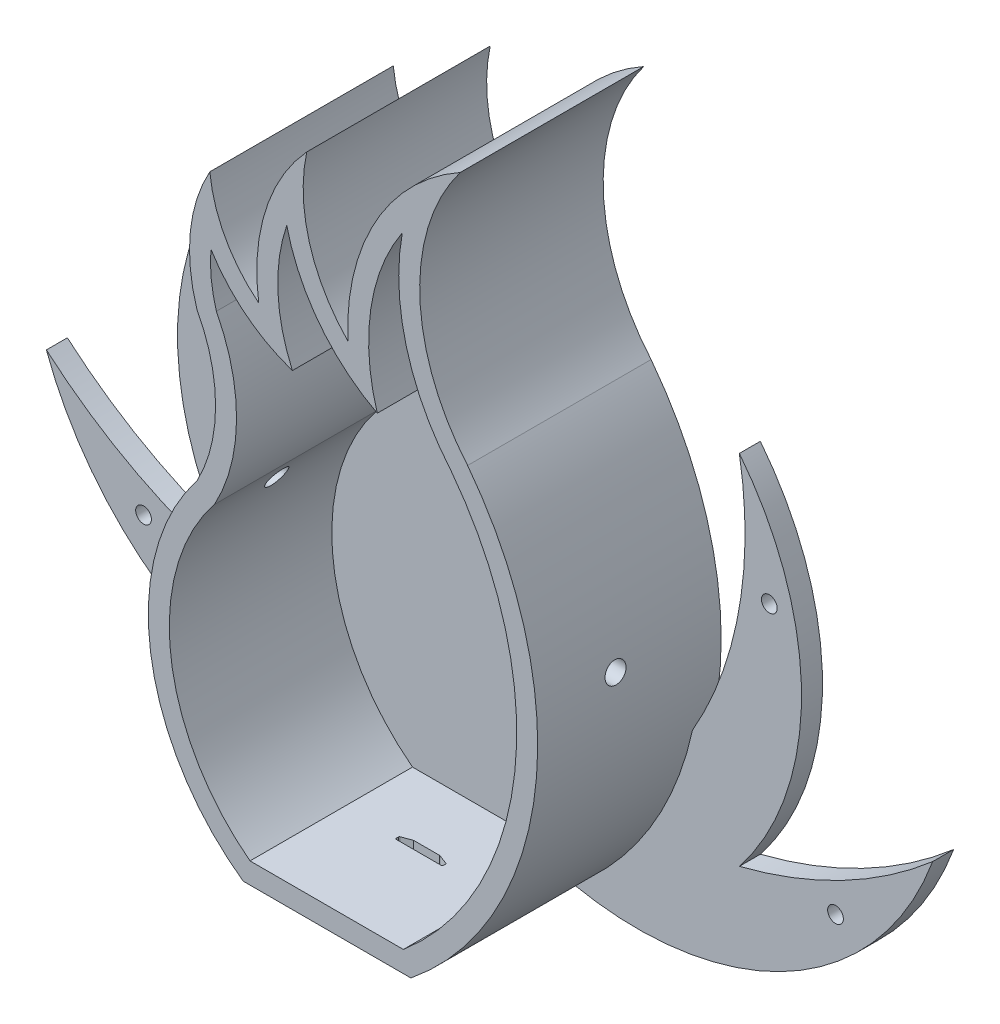
from build123d import *

# Parameters (mm, degrees)
BOSS_EXTRU_1_DEPTH           = 35
COQUE1_START                 = 4
COQUE1_DEPTH                 = 31
ESQUISSE2_R                  = 1.5
BOSS_EXTRU_2_DEPTH           = 4
ENL_V_MAT_EXTRU_1_DEPTH      = 175.132380731
ENL_V_MAT_EXTRU_1_DEPTH_BACK = 175.132380731
ESQUISSE3_R                  = 2
ENL_V_MAT_EXTRU_3_REACH      = 176.132


# Read off the part's stored shape, not the designer's step: Coque1
with BuildPart() as part:
    # Esquisse1 → Boss.-Extru.1 (new body)
    with BuildSketch(Plane.XY):
        with BuildLine():
            Line((0, 0), (32, 0))
            ThreePointArc((32, 0), (55.728066531, 42.841616018), (42.820629182, 90.083792782))
            ThreePointArc((42.820629182, 90.083792782), (33.698409335, 113.699589876), (41.435424367, 137.804762884))
            ThreePointArc((41.435424367, 137.804762884), (25.22744291, 121.551637289), (19.984387859, 99.204979189))
            ThreePointArc((19.984387859, 99.204979189), (12.61609693, 111.881969553), (12.136039681, 126.536912097))
            ThreePointArc((12.136039681, 126.536912097), (4.219515773, 112.802914106), (2.969732835, 97))
            ThreePointArc((2.969732835, 97), (-3.409170119, 104.566084027), (-6.3525056, 114.014512821))
            ThreePointArc((-6.3525056, 114.014512821), (-10.072723061, 102.291129965), (-8.812437557, 90.056367852))
            ThreePointArc((-8.812437557, 90.056367852), (-5.254890234, 75.901823785), (-8.797583956, 61.743554757))
            ThreePointArc((-8.797583956, 61.743554757), (-17.657714331, 28.982568326), (0, 0))
        make_face()
    extrude(amount=BOSS_EXTRU_1_DEPTH)

    # Coque1 outline → Coque1 (cut)
    with BuildSketch(Plane.XY.offset(COQUE1_START)):
        with BuildLine():
            ThreePointArc((-5.450317373, 59.524921192), (-13.80168075, 30.333767047), (1.311276064, 4))
            Line((1.311276064, 4), (30.562561826, 4))
            ThreePointArc((30.562561826, 4), (51.829960407, 43.957714999), (39.70782155, 87.569353124))
            ThreePointArc((39.70782155, 87.569353124), (31.129906971, 103.87080592), (30.352555686, 122.274982261))
            ThreePointArc((30.352555686, 122.274982261), (24.349701453, 106.719246419), (25.584028276, 90.091209439))
            ThreePointArc((25.584028276, 90.091209439), (14.515213943, 99.414058708), (8.326368872, 112.495815697))
            ThreePointArc((8.326368872, 112.495815697), (6.635364168, 100.670475038), (9.39901844, 89.048926361))
            ThreePointArc((9.39901844, 89.048926361), (0.546946732, 93.816298878), (-6.145312397, 101.319676916))
            ThreePointArc((-6.145312397, 101.319676916), (-6.081248931, 96.409310993), (-5.102512487, 91.597048261))
            ThreePointArc((-5.102512487, 91.597048261), (-1.256885168, 75.517395098), (-5.450317373, 59.524921192))
        make_face()
    extrude(amount=COQUE1_DEPTH, mode=Mode.SUBTRACT)

    # Esquisse2 → Boss.-Extru.2 (add)
    # profile 1 of 2: a face of its own
    with BuildSketch(Plane.XY):
        with BuildLine():
            Line((32, 0), (32, 12.299667719))
            ThreePointArc((32, 12.299667719), (58.802567763, 44.999332283), (63.659481669, 87))
            ThreePointArc((63.659481669, 87), (75.517173587, 52.886347991), (63.659481669, 18.772695982))
            ThreePointArc((63.659481669, 18.772695982), (83.222118055, 26.227396664), (100.533244977, 38))
            ThreePointArc((100.533244977, 38), (73.327044482, 6.266483418), (32, 0))
        make_face()
        with Locations((69.376907093, 65)):
            Circle(ESQUISSE2_R, mode=Mode.SUBTRACT)
        with Locations((82, 20)):
            Circle(ESQUISSE2_R, mode=Mode.SUBTRACT)
    # profile 2 of 2: a face of its own
    with BuildSketch(Plane.XY):
        with BuildLine():
            Line((0, 0), (0, 12.299667719))
            ThreePointArc((0, 12.299667719), (-26.802567763, 44.999332283), (-31.659481669, 87))
            ThreePointArc((-31.659481669, 87), (-43.517173587, 52.886347991), (-31.659481669, 18.772695982))
            ThreePointArc((-31.659481669, 18.772695982), (-51.222118055, 26.227396664), (-68.533244977, 38))
            ThreePointArc((-68.533244977, 38), (-41.327044482, 6.266483418), (0, 0))
        make_face()
        with Locations(Location((-50, 20, 0), (0, 0, 180))):
            Circle(ESQUISSE2_R, mode=Mode.SUBTRACT)
        with Locations(Location((-37.376907093, 65, 0), (0, 0, 180))):
            Circle(ESQUISSE2_R, mode=Mode.SUBTRACT)
    extrude(amount=BOSS_EXTRU_2_DEPTH)

    # Esquisse3 → Enlèv. mat.-Extru.1 (cut, two sides: drawn at the far end of the back side and taken through both)
    with BuildSketch(Plane(origin=(0, 0, 0), x_dir=(0, 0, -1), z_dir=(1, 0, 0)).offset(-ENL_V_MAT_EXTRU_1_DEPTH_BACK)):
        with Locations((-20, 55)):
            Circle(ESQUISSE3_R)
    extrude(amount=ENL_V_MAT_EXTRU_1_DEPTH + ENL_V_MAT_EXTRU_1_DEPTH_BACK, mode=Mode.SUBTRACT)

    # Esquisse4 → Enlèv. mat.-Extru.3 (cut, up to next)
    with BuildSketch(Plane.XZ, mode=Mode.PRIVATE) as enl_v_mat_extru_3_sk1:
        with BuildLine():
            Line((13.536266916, 16), (18.463733084, 16))
            ThreePointArc((18.463733084, 16), (18.499418045, 16.00320929), (18.533957772, 16.012734164))
            Line((18.533957772, 16.012734164), (20.370224688, 16.701334258))
            ThreePointArc((20.370224688, 16.701334258), (20.464385124, 16.774681126), (20.5, 16.888600094))
            Line((20.5, 16.888600094), (20.5, 17.3))
            ThreePointArc((20.5, 17.3), (20.441421356, 17.441421356), (20.3, 17.5))
            Line((20.3, 17.5), (11.7, 17.5))
            ThreePointArc((11.7, 17.5), (11.558578644, 17.441421356), (11.5, 17.3))
            Line((11.5, 17.3), (11.5, 16.888600094))
            ThreePointArc((11.5, 16.888600094), (11.535614876, 16.774681126), (11.629775312, 16.701334258))
            Line((11.629775312, 16.701334258), (13.536266916, 16))
        make_face()
    enl_v_mat_extru_3_tool1 = extrude(enl_v_mat_extru_3_sk1.sketch, amount=-ENL_V_MAT_EXTRU_3_REACH, mode=Mode.PRIVATE) & part.part
    add(enl_v_mat_extru_3_tool1.solids().sort_by_distance((16.003291, 0, 16.812223))[0], mode=Mode.SUBTRACT)


solid = part.part
